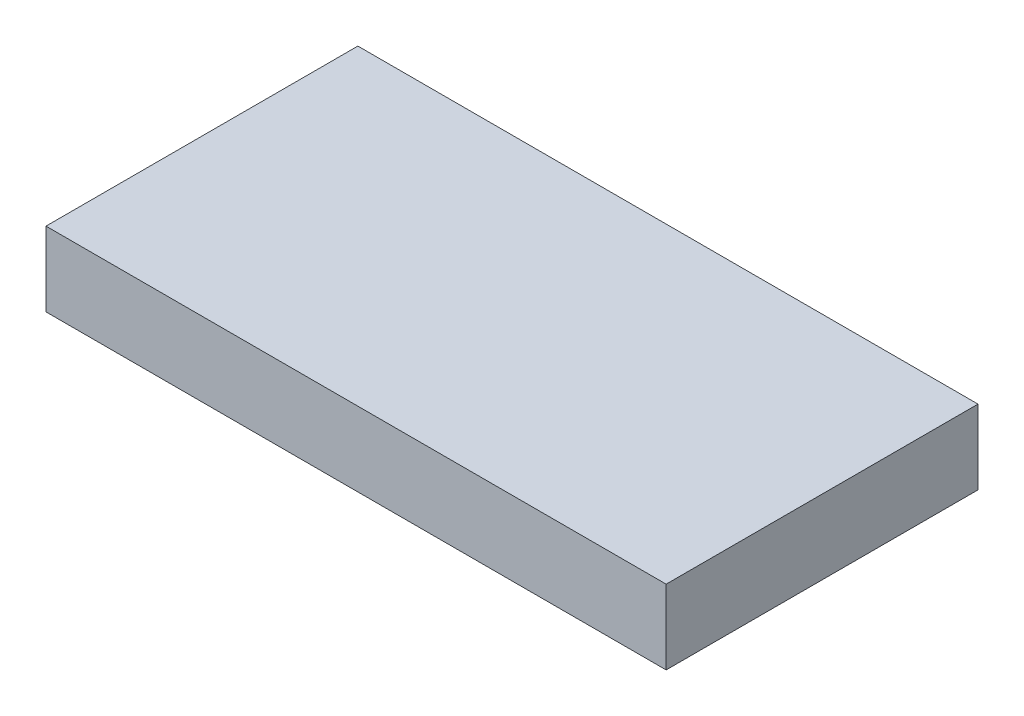
from build123d import *

# Parameters (mm, degrees)
ESBO_O1_W          = 79.54
ESBO_O1_H          = 40
FLANGE_BASE1_DEPTH = 9.53


# Sheet-metal steps are written as plain solids
with BuildPart() as part:
    # Esboço1 → Flange-base1 (new body)
    with BuildSketch(Plane(origin=(0, 0, 0), x_dir=(1, 0, 0), z_dir=(0, 1, 0))):
        Rectangle(ESBO_O1_W, ESBO_O1_H)
    extrude(amount=-FLANGE_BASE1_DEPTH)


solid = part.part
